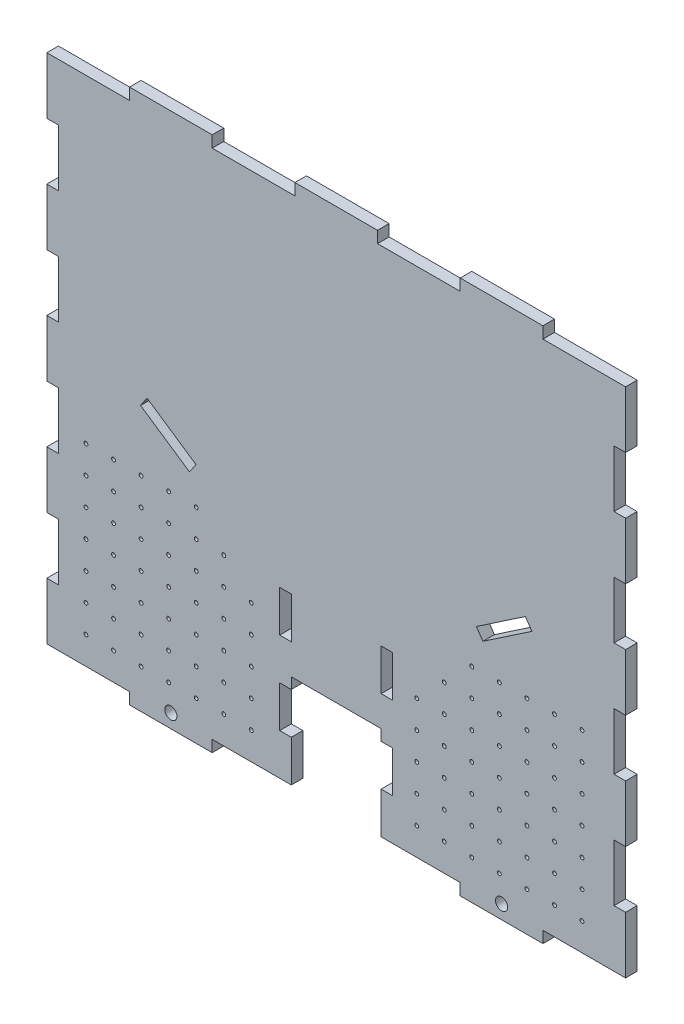
from build123d import *

# Parameters (mm, degrees)
SKETCH1_W           = 266.7
SKETCH1_H           = 246.5832
BOSS_EXTRUDE1_DEPTH = 5.334
SKETCH3_W           = 38.1
SKETCH3_H           = 5.334
CUT_EXTRUDE1_DEPTH  = 326.142186061
SKETCH4_W           = 5.334
SKETCH4_H           = 19.05
CUT_EXTRUDE2_DEPTH  = 326.142186061
SKETCH5_W           = 5.334
SKETCH5_H           = 26.2128
CUT_EXTRUDE3_DEPTH  = 326.142186061
SKETCH6_R           = 0.889
CUT_EXTRUDE4_DEPTH  = 326.142186061
SKETCH7_W           = 41.402
SKETCH7_H           = 48.514
CUT_EXTRUDE5_DEPTH  = 326.142186061
SKETCH8_R           = 2.794
CUT_EXTRUDE6_DEPTH  = 326.142186061


with BuildPart() as part:
    # Sketch1 → Boss-Extrude1 (new body)
    with BuildSketch(Plane.XY):
        with Locations((-107.591743392, 94.965280514)):
            Rectangle(SKETCH1_W, SKETCH1_H)
    extrude(amount=BOSS_EXTRUDE1_DEPTH)

    # Sketch3 → Cut-Extrude1 (cut, through all)
    with BuildSketch(Plane.XY.offset(5.334)):
        with Locations((-221.891743392, 215.589880514)):
            Rectangle(SKETCH3_W, SKETCH3_H)
        with Locations((-145.691743392, 215.589880514)):
            Rectangle(SKETCH3_W, SKETCH3_H)
        with Locations((-69.491743392, 215.589880514)):
            Rectangle(SKETCH3_W, SKETCH3_H)
        with Locations((6.708256608, 215.589880514)):
            Rectangle(SKETCH3_W, SKETCH3_H)
        with Locations((6.708256608, -25.659319486)):
            Rectangle(SKETCH3_W, SKETCH3_H)
        with Locations((-69.491743392, -25.659319486)):
            Rectangle(SKETCH3_W, SKETCH3_H)
        with Locations((-145.691743392, -25.659319486)):
            Rectangle(SKETCH3_W, SKETCH3_H)
        with Locations((-221.891743392, -25.659319486)):
            Rectangle(SKETCH3_W, SKETCH3_H)
    extrude(amount=-CUT_EXTRUDE1_DEPTH, mode=Mode.SUBTRACT)

    # Sketch4 → Cut-Extrude2 (cut, through all)
    with BuildSketch(Plane.XY.offset(5.334)):
        with Locations((-130.959743392, 43.682680514)):
            Rectangle(SKETCH4_W, SKETCH4_H)
        with Locations((-130.959743392, 5.582680514)):
            Rectangle(SKETCH4_W, SKETCH4_H)
        Polygon((-172.200485432, 82.908520677), (-175.189075092, 78.490388963), (-197.753829731, 93.754033589), (-194.765240071, 98.172165303), align=None)
        Polygon((-20.418246712, 98.172165303), (-17.429657052, 93.754033589), (-39.994411692, 78.490388963), (-42.983001352, 82.908520677), align=None)
        with Locations((-84.223743392, 5.582680514)):
            Rectangle(SKETCH4_W, SKETCH4_H)
        with Locations((-84.223743392, 43.682680514)):
            Rectangle(SKETCH4_W, SKETCH4_H)
    extrude(amount=-CUT_EXTRUDE2_DEPTH, mode=Mode.SUBTRACT)

    # Sketch5 → Cut-Extrude3 (cut, through all)
    with BuildSketch(Plane.XY.offset(5.334)):
        with Locations((-238.274743392, 173.603680514)):
            Rectangle(SKETCH5_W, SKETCH5_H)
        with Locations((-238.274743392, 121.178080514)):
            Rectangle(SKETCH5_W, SKETCH5_H)
        with Locations((-238.274743392, 68.752480514)):
            Rectangle(SKETCH5_W, SKETCH5_H)
        with Locations((-238.274743392, 16.326880514)):
            Rectangle(SKETCH5_W, SKETCH5_H)
        with Locations((23.091256608, 16.326880514)):
            Rectangle(SKETCH5_W, SKETCH5_H)
        with Locations((23.091256608, 68.752480514)):
            Rectangle(SKETCH5_W, SKETCH5_H)
        with Locations((23.091256608, 121.178080514)):
            Rectangle(SKETCH5_W, SKETCH5_H)
        with Locations((23.091256608, 173.603680514)):
            Rectangle(SKETCH5_W, SKETCH5_H)
    extrude(amount=-CUT_EXTRUDE3_DEPTH, mode=Mode.SUBTRACT)

    # Sketch6 → Cut-Extrude4 (cut, through all)
    with BuildSketch(Plane.XY.offset(5.334)):
        with Locations((-222.907743392, -10.292319486)):
            Circle(SKETCH6_R)
        with Locations((-210.207743392, -10.292319486)):
            Circle(SKETCH6_R)
        with Locations((-197.507743392, -10.292319486)):
            Circle(SKETCH6_R)
        with Locations((-184.807743392, -10.292319486)):
            Circle(SKETCH6_R)
        with Locations((-172.107743392, -10.292319486)):
            Circle(SKETCH6_R)
        with Locations((-159.407743392, -10.292319486)):
            Circle(SKETCH6_R)
        with Locations((-146.707743392, -10.292319486)):
            Circle(SKETCH6_R)
        with Locations((-70.507743392, -10.292319486)):
            Circle(SKETCH6_R)
        with Locations((-57.807743392, -10.292319486)):
            Circle(SKETCH6_R)
        with Locations((-45.107743392, -10.292319486)):
            Circle(SKETCH6_R)
        with Locations((-32.407743392, -10.292319486)):
            Circle(SKETCH6_R)
        with Locations((-19.707743392, -10.292319486)):
            Circle(SKETCH6_R)
        with Locations((-7.007743392, -10.292319486)):
            Circle(SKETCH6_R)
        with Locations((5.692256608, -10.292319486)):
            Circle(SKETCH6_R)
        with Locations((-210.207743392, 2.407680514)):
            Circle(SKETCH6_R)
        with Locations((-197.507743392, 2.407680514)):
            Circle(SKETCH6_R)
        with Locations((-184.807743392, 2.407680514)):
            Circle(SKETCH6_R)
        with Locations((-172.107743392, 2.407680514)):
            Circle(SKETCH6_R)
        with Locations((-159.407743392, 2.407680514)):
            Circle(SKETCH6_R)
        with Locations((-146.707743392, 2.407680514)):
            Circle(SKETCH6_R)
        with Locations((-70.507743392, 2.407680514)):
            Circle(SKETCH6_R)
        with Locations((-57.807743392, 2.407680514)):
            Circle(SKETCH6_R)
        with Locations((-45.107743392, 2.407680514)):
            Circle(SKETCH6_R)
        with Locations((-32.407743392, 2.407680514)):
            Circle(SKETCH6_R)
        with Locations((-19.707743392, 2.407680514)):
            Circle(SKETCH6_R)
        with Locations((-7.007743392, 2.407680514)):
            Circle(SKETCH6_R)
        with Locations((5.692256608, 2.407680514)):
            Circle(SKETCH6_R)
        with Locations((-210.207743392, 15.107680514)):
            Circle(SKETCH6_R)
        with Locations((-197.507743392, 15.107680514)):
            Circle(SKETCH6_R)
        with Locations((-184.807743392, 15.107680514)):
            Circle(SKETCH6_R)
        with Locations((-172.107743392, 15.107680514)):
            Circle(SKETCH6_R)
        with Locations((-159.407743392, 15.107680514)):
            Circle(SKETCH6_R)
        with Locations((-146.707743392, 15.107680514)):
            Circle(SKETCH6_R)
        with Locations((-70.507743392, 15.107680514)):
            Circle(SKETCH6_R)
        with Locations((-57.807743392, 15.107680514)):
            Circle(SKETCH6_R)
        with Locations((-45.107743392, 15.107680514)):
            Circle(SKETCH6_R)
        with Locations((-32.407743392, 15.107680514)):
            Circle(SKETCH6_R)
        with Locations((-19.707743392, 15.107680514)):
            Circle(SKETCH6_R)
        with Locations((-7.007743392, 15.107680514)):
            Circle(SKETCH6_R)
        with Locations((5.692256608, 15.107680514)):
            Circle(SKETCH6_R)
        with Locations((-210.207743392, 27.807680514)):
            Circle(SKETCH6_R)
        with Locations((-197.507743392, 27.807680514)):
            Circle(SKETCH6_R)
        with Locations((-184.807743392, 27.807680514)):
            Circle(SKETCH6_R)
        with Locations((-172.107743392, 27.807680514)):
            Circle(SKETCH6_R)
        with Locations((-159.407743392, 27.807680514)):
            Circle(SKETCH6_R)
        with Locations((-146.707743392, 27.807680514)):
            Circle(SKETCH6_R)
        with Locations((-70.507743392, 27.807680514)):
            Circle(SKETCH6_R)
        with Locations((-57.807743392, 27.807680514)):
            Circle(SKETCH6_R)
        with Locations((-45.107743392, 27.807680514)):
            Circle(SKETCH6_R)
        with Locations((-32.407743392, 27.807680514)):
            Circle(SKETCH6_R)
        with Locations((-19.707743392, 27.807680514)):
            Circle(SKETCH6_R)
        with Locations((-7.007743392, 27.807680514)):
            Circle(SKETCH6_R)
        with Locations((5.692256608, 27.807680514)):
            Circle(SKETCH6_R)
        with Locations((-210.207743392, 40.507680514)):
            Circle(SKETCH6_R)
        with Locations((-197.507743392, 40.507680514)):
            Circle(SKETCH6_R)
        with Locations((-184.807743392, 40.507680514)):
            Circle(SKETCH6_R)
        with Locations((-172.107743392, 40.507680514)):
            Circle(SKETCH6_R)
        with Locations((-159.407743392, 40.507680514)):
            Circle(SKETCH6_R)
        with Locations((-146.707743392, 40.507680514)):
            Circle(SKETCH6_R)
        with Locations((-70.507743392, 40.507680514)):
            Circle(SKETCH6_R)
        with Locations((-57.807743392, 40.507680514)):
            Circle(SKETCH6_R)
        with Locations((-45.107743392, 40.507680514)):
            Circle(SKETCH6_R)
        with Locations((-32.407743392, 40.507680514)):
            Circle(SKETCH6_R)
        with Locations((-19.707743392, 40.507680514)):
            Circle(SKETCH6_R)
        with Locations((-7.007743392, 40.507680514)):
            Circle(SKETCH6_R)
        with Locations((5.692256608, 40.507680514)):
            Circle(SKETCH6_R)
        with Locations((-210.207743392, 53.207680514)):
            Circle(SKETCH6_R)
        with Locations((-197.507743392, 53.207680514)):
            Circle(SKETCH6_R)
        with Locations((-184.807743392, 53.207680514)):
            Circle(SKETCH6_R)
        with Locations((-172.107743392, 53.207680514)):
            Circle(SKETCH6_R)
        with Locations((-159.407743392, 53.207680514)):
            Circle(SKETCH6_R)
        with Locations((-57.807743392, 53.207680514)):
            Circle(SKETCH6_R)
        with Locations((-45.107743392, 53.207680514)):
            Circle(SKETCH6_R)
        with Locations((-32.407743392, 53.207680514)):
            Circle(SKETCH6_R)
        with Locations((-19.707743392, 53.207680514)):
            Circle(SKETCH6_R)
        with Locations((-7.007743392, 53.207680514)):
            Circle(SKETCH6_R)
        with Locations((5.692256608, 53.207680514)):
            Circle(SKETCH6_R)
        with Locations((-210.207743392, 65.907680514)):
            Circle(SKETCH6_R)
        with Locations((-197.507743392, 65.907680514)):
            Circle(SKETCH6_R)
        with Locations((-184.807743392, 65.907680514)):
            Circle(SKETCH6_R)
        with Locations((-172.107743392, 65.907680514)):
            Circle(SKETCH6_R)
        with Locations((-45.107743392, 65.907680514)):
            Circle(SKETCH6_R)
        with Locations((-32.407743392, 65.907680514)):
            Circle(SKETCH6_R)
        with Locations((-19.707743392, 65.907680514)):
            Circle(SKETCH6_R)
        with Locations((-7.007743392, 65.907680514)):
            Circle(SKETCH6_R)
        with Locations((5.692256608, 65.907680514)):
            Circle(SKETCH6_R)
        with Locations((-222.907743392, 2.407680514)):
            Circle(SKETCH6_R)
        with Locations((-222.907743392, 15.107680514)):
            Circle(SKETCH6_R)
        with Locations((-222.907743392, 27.807680514)):
            Circle(SKETCH6_R)
        with Locations((-222.907743392, 40.507680514)):
            Circle(SKETCH6_R)
        with Locations((-222.907743392, 53.207680514)):
            Circle(SKETCH6_R)
        with Locations((-222.907743392, 65.907680514)):
            Circle(SKETCH6_R)
    extrude(amount=-CUT_EXTRUDE4_DEPTH, mode=Mode.SUBTRACT)

    # Sketch7 → Cut-Extrude5 (cut, through all)
    with BuildSketch(Plane.XY.offset(5.334)):
        with Locations((-107.591743392, -4.069319486)):
            Rectangle(SKETCH7_W, SKETCH7_H)
    extrude(amount=-CUT_EXTRUDE5_DEPTH, mode=Mode.SUBTRACT)

    # Sketch8 → Cut-Extrude6 (cut, through all)
    with BuildSketch(Plane.XY.offset(5.334)):
        with Locations((-183.791743392, -21.976319486)):
            Circle(SKETCH8_R)
        with Locations((-31.391743392, -21.976319486)):
            Circle(SKETCH8_R)
    extrude(amount=-CUT_EXTRUDE6_DEPTH, mode=Mode.SUBTRACT)


solid = part.part
